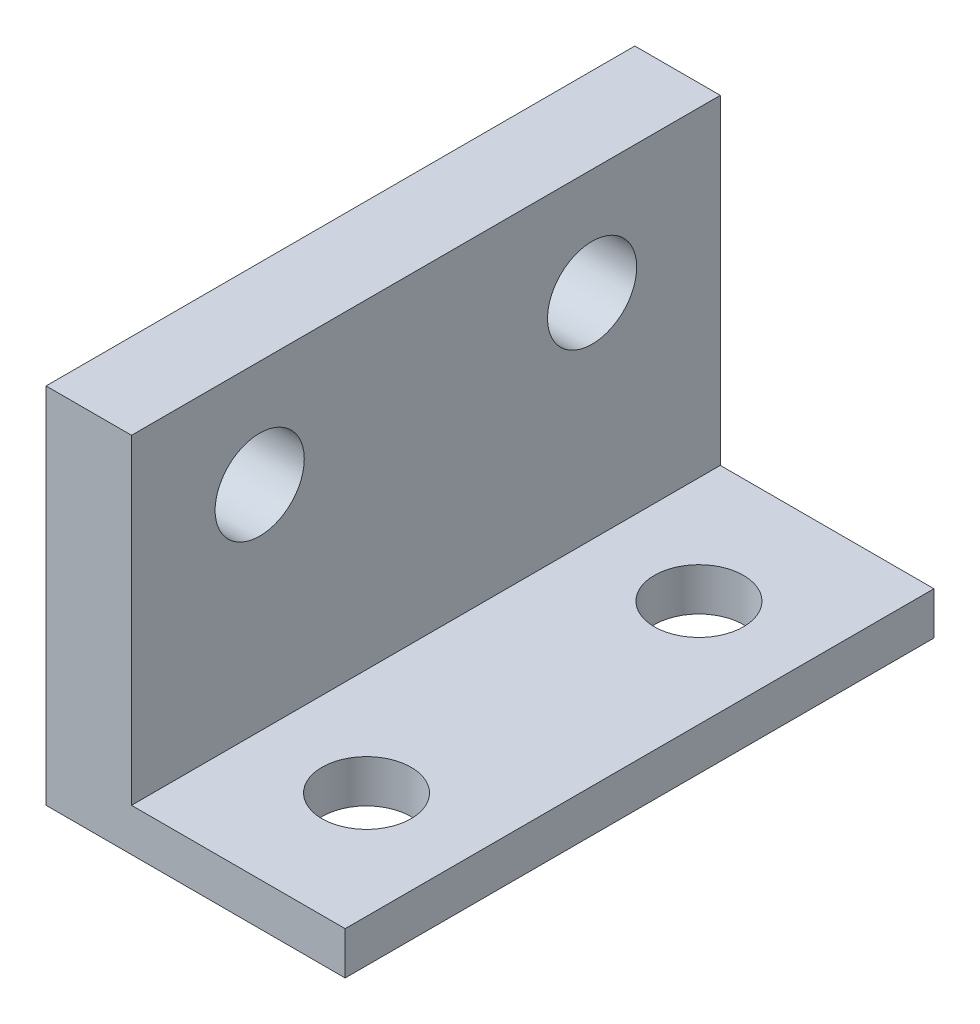
from build123d import *

# Parameters (mm, degrees)
SKETCH1_W             = 5.08
SKETCH1_H             = 19.05
BOSS_EXTRUDE1_DEPTH   = 35
F_5_0MM_DOWEL_HOLE1_D = 5.3
F_5_0MM_DOWEL_HOLE2_D = 5.3


with BuildPart() as part:
    # Sketch1 → Boss-Extrude1 (new body)
    with BuildSketch(Plane.XY):
        Polygon((0, 2.54), (0, 0), (17.78, 0), (17.78, 2.54), (5.08, 2.54), align=None)
        with Locations((2.54, 12.065)):
            Rectangle(SKETCH1_W, SKETCH1_H)
    extrude(amount=BOSS_EXTRUDE1_DEPTH)

    # Ø5.0mm Dowel Hole1 (through all)
    with Locations(Plane(origin=(5.08, 0, 0), x_dir=(0, 0, -1), z_dir=(1, 0, 0))):
        with Locations((-27.38, 15.24), (-7.62, 15.24)):
            Hole(F_5_0MM_DOWEL_HOLE1_D / 2)

    # Ø5.0mm Dowel Hole2 (through all)
    with Locations(Plane(origin=(0, 2.54, 0), x_dir=(1, 0, 0), z_dir=(0, 1, 0))):
        with Locations((11.43, -27.38), (11.43, -7.62)):
            Hole(F_5_0MM_DOWEL_HOLE2_D / 2)


solid = part.part
